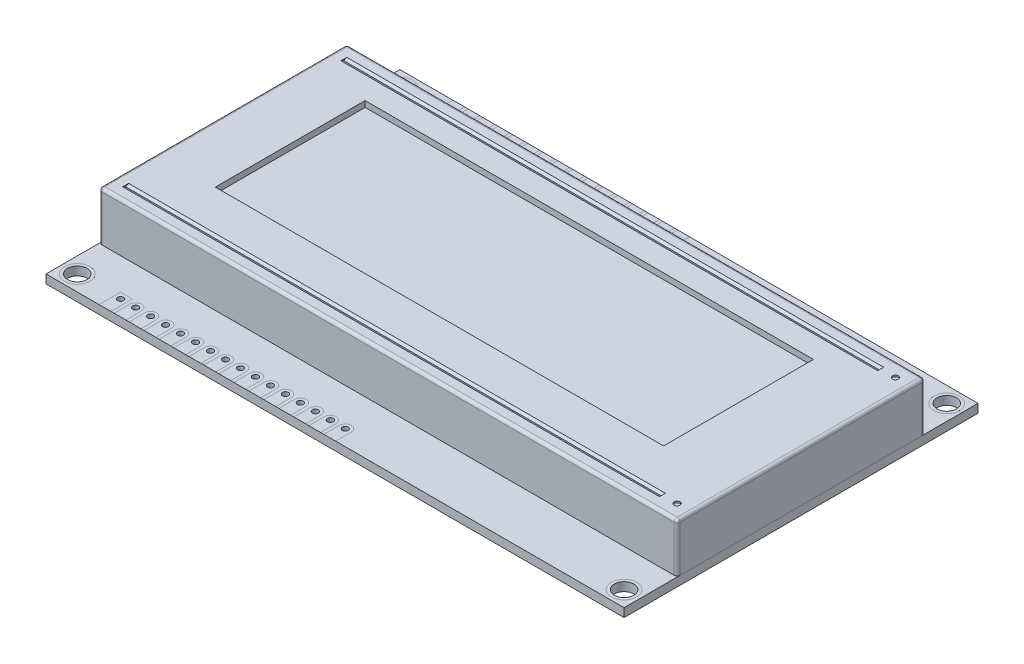
from build123d import *
from OCP.BRepFilletAPI import BRepFilletAPI_MakeChamfer

# Parameters (mm, degrees)
SKETCH1_W             = 98
SKETCH1_H             = 60
BOSS_EXTRUDE1_DEPTH   = 1.46
SKETCH1_3_R           = 2.15
CUT_EXTRUDE1_DEPTH    = 58.600816834
SKETCH1_4_R           = 2.15
SKETCH1_4_R_2         = 1.65
BOSS_EXTRUDE2_DEPTH   = 1.46
BOSS_EXTRUDE2_2_DEPTH = 1.46
BOSS_EXTRUDE2_3_DEPTH = 1.46
BOSS_EXTRUDE2_4_DEPTH = 1.46
SKETCH1_5_W           = 98
SKETCH1_5_H           = 42
BOSS_EXTRUDE3_DEPTH   = 8.3
SKETCH2_W             = 76
SKETCH2_H             = 25.4
CUT_EXTRUDE2_DEPTH    = 1
SKETCH3_R             = 0.5
SKETCH3_W             = 91
SKETCH3_H             = 1
CUT_EXTRUDE3_DEPTH    = 0.25
CHAMFER1_SIZE         = 0.25
CHAMFER1_SIZE_2       = 0.5
FILLET1_R             = 0.5
SKETCH4_7_R           = 0.5
CUT_EXTRUDE9_DEPTH    = 59.177422597


with BuildPart() as part:
    # Sketch1 → Boss-Extrude1 (new body)
    with BuildSketch(Plane(origin=(0, 0, 0), x_dir=(1, 0, 0), z_dir=(0, 1, 0))):
        with Locations((-0.15, 0)):
            Rectangle(SKETCH1_W, SKETCH1_H)
    extrude(amount=-BOSS_EXTRUDE1_DEPTH)

    # Sketch1<3> → Cut-Extrude1 (cut, through all)
    with BuildSketch(Plane(origin=(0, 0, 0), x_dir=(1, 0, 0), z_dir=(0, 1, 0))):
        with Locations(Location((-46.5, 27.35, 0), (0, 0, 270))):
            Circle(SKETCH1_3_R)
        with Locations(Location((46.2, 27.35, 0), (0, 0, 90))):
            Circle(SKETCH1_3_R)
        with Locations(Location((46.2, -27.35, 0), (0, 0, 270))):
            Circle(SKETCH1_3_R)
        with Locations(Location((-46.5, -27.35, 0), (0, 0, 90))):
            Circle(SKETCH1_3_R)
    extrude(amount=-CUT_EXTRUDE1_DEPTH, mode=Mode.SUBTRACT)

    # Sketch4<7> → Cut-Extrude9 (cut, through all)
    with BuildSketch(Plane(origin=(0, 0, 0), x_dir=(1, 0, 0), z_dir=(0, 1, 0))):
        with Locations(Location((-39.15, 27.35, 0), (0, 0, 270))):
            Circle(SKETCH4_7_R)
        with Locations(Location((-36.61, 27.35, 0), (0, 0, 270))):
            Circle(SKETCH4_7_R)
        with Locations(Location((-34.07, 27.35, 0), (0, 0, 270))):
            Circle(SKETCH4_7_R)
        with Locations(Location((-31.53, 27.35, 0), (0, 0, 270))):
            Circle(SKETCH4_7_R)
        with Locations(Location((-28.99, 27.35, 0), (0, 0, 270))):
            Circle(SKETCH4_7_R)
        with Locations(Location((-26.45, 27.35, 0), (0, 0, 270))):
            Circle(SKETCH4_7_R)
        with Locations(Location((-23.91, 27.35, 0), (0, 0, 270))):
            Circle(SKETCH4_7_R)
        with Locations(Location((-21.37, 27.35, 0), (0, 0, 270))):
            Circle(SKETCH4_7_R)
        with Locations(Location((-18.83, 27.35, 0), (0, 0, 270))):
            Circle(SKETCH4_7_R)
        with Locations(Location((-16.29, 27.35, 0), (0, 0, 270))):
            Circle(SKETCH4_7_R)
        with Locations(Location((-13.75, 27.35, 0), (0, 0, 270))):
            Circle(SKETCH4_7_R)
        with Locations(Location((-11.21, 27.35, 0), (0, 0, 270))):
            Circle(SKETCH4_7_R)
        with Locations(Location((-8.67, 27.35, 0), (0, 0, 270))):
            Circle(SKETCH4_7_R)
        with Locations(Location((-6.13, 27.35, 0), (0, 0, 270))):
            Circle(SKETCH4_7_R)
        with Locations(Location((-3.59, 27.35, 0), (0, 0, 270))):
            Circle(SKETCH4_7_R)
        with Locations(Location((-1.05, 27.35, 0), (0, 0, 270))):
            Circle(SKETCH4_7_R)
    cut_extrude9 = extrude(amount=-CUT_EXTRUDE9_DEPTH, mode=Mode.SUBTRACT)

    # Mirror1: Cut-Extrude9 across plane
    add(cut_extrude9.mirror(Plane.XY), mode=Mode.SUBTRACT)


with BuildPart() as body_2:
    # Sketch1<4> → Boss-Extrude2 (new body)
    with BuildSketch(Plane(origin=(0, 0, 0), x_dir=(1, 0, 0), z_dir=(0, 1, 0))):
        with Locations(Location((-46.5, 27.35, 0), (0, 0, 270))):
            Circle(SKETCH1_4_R)
        with Locations(Location((-46.5, 27.35, 0), (0, 0, 270))):
            Circle(SKETCH1_4_R_2, mode=Mode.SUBTRACT)
    extrude(amount=-BOSS_EXTRUDE2_DEPTH)


with BuildPart() as body_3:
    # Sketch1<4> → Boss-Extrude2 2 (new body)
    with BuildSketch(Plane(origin=(0, 0, 0), x_dir=(1, 0, 0), z_dir=(0, 1, 0))):
        with Locations(Location((46.2, 27.35, 0), (0, 0, 270))):
            Circle(SKETCH1_4_R)
        with Locations(Location((46.2, 27.35, 0), (0, 0, 270))):
            Circle(SKETCH1_4_R_2, mode=Mode.SUBTRACT)
    extrude(amount=-BOSS_EXTRUDE2_2_DEPTH)


with BuildPart() as body_4:
    # Sketch1<4> → Boss-Extrude2 3 (new body)
    with BuildSketch(Plane(origin=(0, 0, 0), x_dir=(1, 0, 0), z_dir=(0, 1, 0))):
        with Locations(Location((46.2, -27.35, 0), (0, 0, 270))):
            Circle(SKETCH1_4_R)
        with Locations(Location((46.2, -27.35, 0), (0, 0, 270))):
            Circle(SKETCH1_4_R_2, mode=Mode.SUBTRACT)
    extrude(amount=-BOSS_EXTRUDE2_3_DEPTH)


with BuildPart() as body_5:
    # Sketch1<4> → Boss-Extrude2 4 (new body)
    with BuildSketch(Plane(origin=(0, 0, 0), x_dir=(1, 0, 0), z_dir=(0, 1, 0))):
        with Locations(Location((-46.5, -27.35, 0), (0, 0, 270))):
            Circle(SKETCH1_4_R)
        with Locations(Location((-46.5, -27.35, 0), (0, 0, 270))):
            Circle(SKETCH1_4_R_2, mode=Mode.SUBTRACT)
    extrude(amount=-BOSS_EXTRUDE2_4_DEPTH)


with BuildPart() as body_6:
    # Sketch1<5> → Boss-Extrude3 (new body)
    with BuildSketch(Plane(origin=(0, 0, 0), x_dir=(1, 0, 0), z_dir=(0, 1, 0))):
        with Locations((-0.15, 0)):
            Rectangle(SKETCH1_5_W, SKETCH1_5_H)
    extrude(amount=BOSS_EXTRUDE3_DEPTH)

    # Sketch2 → Cut-Extrude2 (cut)
    with BuildSketch(Plane(origin=(0, 8.3, 0), x_dir=(-1, 0, 0), z_dir=(0, 1, 0))):
        with Locations((1.25, -1.5)):
            Rectangle(SKETCH2_W, SKETCH2_H)
    extrude(amount=-CUT_EXTRUDE2_DEPTH, mode=Mode.SUBTRACT)

    # Sketch3 → Cut-Extrude3 (cut)
    with BuildSketch(Plane(origin=(0, 8.3, 0), x_dir=(1, 0, 0), z_dir=(0, 1, 0))):
        with Locations(Location((46.35, 18.5, 0), (0, 0, 270))):
            Circle(SKETCH3_R)
        with Locations(Location((46.35, -18.5, 0), (0, 0, 90))):
            Circle(SKETCH3_R)
        with Locations((-1.65, 18.5)):
            Rectangle(SKETCH3_W, SKETCH3_H)
        with Locations((-1.65, -18.5)):
            Rectangle(SKETCH3_W, SKETCH3_H)
    extrude(amount=-CUT_EXTRUDE3_DEPTH, mode=Mode.SUBTRACT)

    # Chamfer1
    chamfer1_edges_1 = [body_6.edges().sort_by_distance(p)[0] for p in [
        (-1.65, 8.05, 19),
    ]]
    chamfer1_side_1 = [body_6.faces().sort_by_distance(p)[0] for p in [
        (-1.65, 8.055, 19),
    ]]
    chamfer1_edges_2 = [body_6.edges().sort_by_distance(p)[0] for p in [
        (-1.65, 8.05, 18),
    ]]
    chamfer1_side_2 = [body_6.faces().sort_by_distance(p)[0] for p in [
        (-1.65, 8.055, 18),
    ]]
    chamfer1_edges_3 = [body_6.edges().sort_by_distance(p)[0] for p in [
        (-1.65, 8.05, -18),
    ]]
    chamfer1_side_3 = [body_6.faces().sort_by_distance(p)[0] for p in [
        (-1.65, 8.055, -18),
    ]]
    chamfer1_edges_4 = [body_6.edges().sort_by_distance(p)[0] for p in [
        (-1.65, 8.05, -19),
    ]]
    chamfer1_side_4 = [body_6.faces().sort_by_distance(p)[0] for p in [
        (-1.65, 8.055, -19),
    ]]
    chamfer1 = BRepFilletAPI_MakeChamfer(body_6.part.solid().wrapped)
    for e in chamfer1_edges_1:
        chamfer1.Add(CHAMFER1_SIZE - 0.0001, CHAMFER1_SIZE_2 - 0.0001, e.wrapped, chamfer1_side_1[0].wrapped)
    for e in chamfer1_edges_2:
        chamfer1.Add(CHAMFER1_SIZE - 0.0001, CHAMFER1_SIZE_2 - 0.0001, e.wrapped, chamfer1_side_2[0].wrapped)
    for e in chamfer1_edges_3:
        chamfer1.Add(CHAMFER1_SIZE - 0.0001, CHAMFER1_SIZE_2 - 0.0001, e.wrapped, chamfer1_side_3[0].wrapped)
    for e in chamfer1_edges_4:
        chamfer1.Add(CHAMFER1_SIZE - 0.0001, CHAMFER1_SIZE_2 - 0.0001, e.wrapped, chamfer1_side_4[0].wrapped)
    add(Compound.cast(chamfer1.Shape()), mode=Mode.REPLACE)  # a hair under: the kernel refuses the full size

    # Fillet1
    fillet1_edges = [body_6.edges().sort_by_distance(p)[0] for p in [
        (-0.15, 8.3, 21),
        (48.85, 8.3, 0),
        (-0.15, 8.3, -21),
        (-49.15, 8.3, 0),
        (-49.15, 4.15, -21),
        (48.85, 4.15, -21),
        (48.85, 4.15, 21),
        (-49.15, 4.15, 21),
    ]]
    fillet(fillet1_edges, radius=FILLET1_R)


solid = Compound([part.part, body_2.part, body_3.part, body_4.part, body_5.part, body_6.part])
